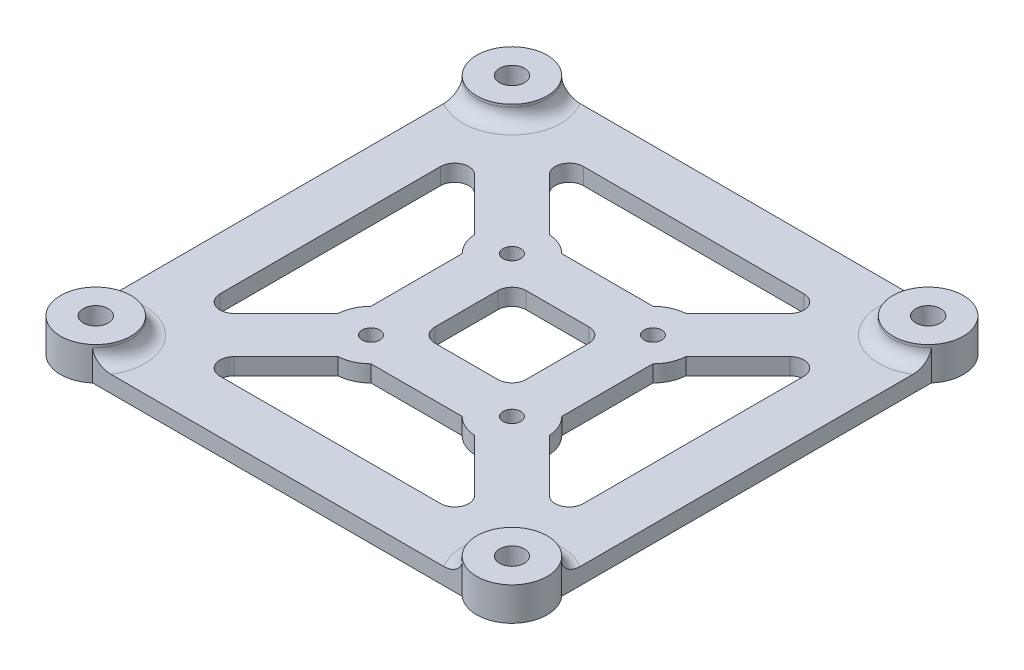
from build123d import *

# Parameters (mm, degrees)
BOSS_EXTRUDE1_DEPTH                        = 3
SKETCH2_R                                  = 6.35
BOSS_EXTRUDE2_DEPTH                        = 3
SKETCH3_R                                  = 1.5875
CUT_EXTRUDE1_DEPTH                         = 63.085787424
FILLET1_R                                  = 2.54
SKETCH4_R                                  = 2.25
CUT_EXTRUDE2_DEPTH                         = 63.302849052
MIRROR1_AT_THE_SECOND_PLANE_COPY_1_SKETC_R = 2.25
MIRROR1_AT_THE_SECOND_PLANE_COPY_1_DEPTH   = 63.302849052
FILLET2_R                                  = 2.54


with BuildPart() as part:
    # Sketch1 → Boss-Extrude1 (new body)
    with BuildSketch(Plane(origin=(0, 0, 0), x_dir=(1, 0, 0), z_dir=(0, 1, 0))):
        with BuildLine():
            ThreePointArc((-32.7375, -33.299869794), (-33.009871939, -33.009871939), (-33.299869794, -32.7375))
            Line((-33.299869794, -32.7375), (-33.299869794, -33.299869794))
            Line((-33.299869794, -33.299869794), (-32.7375, -33.299869794))
        make_face()
        with BuildLine():
            Line((-33.299869794, -33.299869794), (-33.299869794, -32.7375))
            ThreePointArc((-33.299869794, -32.7375), (-37.897655495, -31.162463404), (-42.2625, -33.299869794))
            Line((-42.2625, -33.299869794), (-33.299869794, -33.299869794))
        make_face()
        with BuildLine():
            ThreePointArc((-31.15, -37.5), (-31.560118898, -35.25493597), (-32.7375, -33.299869794))
            Line((-32.7375, -33.299869794), (-33.299869794, -33.299869794))
            Line((-33.299869794, -33.299869794), (-33.299869794, -42.2625))
            ThreePointArc((-33.299869794, -42.2625), (-31.712369794, -40.112630206), (-31.15, -37.5))
        make_face()
        with BuildLine():
            Line((-33.299869794, -42.2625), (-33.299869794, -33.299869794))
            Line((-33.299869794, -33.299869794), (-42.2625, -33.299869794))
            ThreePointArc((-42.2625, -33.299869794), (-41.990128061, -41.990128061), (-33.299869794, -42.2625))
        make_face()
        with BuildLine():
            Line((26.002307909, -32.7375), (-26.002307909, -32.7375))
            Line((-26.002307909, -32.7375), (-32.7375, -32.7375))
            Line((-32.7375, -32.7375), (-32.7375, -33.299869794))
            ThreePointArc((-32.7375, -33.299869794), (-31.560118898, -35.25493597), (-31.15, -37.5))
            ThreePointArc((-31.15, -37.5), (-31.712369794, -40.112630206), (-33.299869794, -42.2625))
            Line((-33.299869794, -42.2625), (33.299869794, -42.2625))
            ThreePointArc((33.299869794, -42.2625), (31.162463404, -37.897655495), (32.7375, -33.299869794))
            Line((32.7375, -33.299869794), (32.7375, -32.7375))
            Line((32.7375, -32.7375), (26.002307909, -32.7375))
        make_face()
        with BuildLine():
            Line((-32.7375, -32.7375), (-26.002307909, -32.7375))
            Line((-26.002307909, -32.7375), (-12.302344505, -19.037536596))
            ThreePointArc((-12.302344505, -19.037536596), (-17.190128061, -17.190128061), (-19.037536596, -12.302344505))
            Line((-19.037536596, -12.302344505), (-32.7375, -26.002307909))
            Line((-32.7375, -26.002307909), (-32.7375, -32.7375))
        make_face()
        with BuildLine():
            Line((-33.299869794, -32.7375), (-32.7375, -32.7375))
            Line((-32.7375, -32.7375), (-32.7375, -26.002307909))
            Line((-32.7375, -26.002307909), (-32.7375, 26.002307909))
            Line((-32.7375, 26.002307909), (-32.7375, 32.7375))
            Line((-32.7375, 32.7375), (-33.299869794, 32.7375))
            ThreePointArc((-33.299869794, 32.7375), (-37.897655495, 31.162463404), (-42.2625, 33.299869794))
            Line((-42.2625, 33.299869794), (-42.2625, -33.299869794))
            ThreePointArc((-42.2625, -33.299869794), (-37.897655495, -31.162463404), (-33.299869794, -32.7375))
        make_face()
        with BuildLine():
            ThreePointArc((-19.037536596, -12.302344505), (-17.190128061, -17.190128061), (-12.302344505, -19.037536596))
            ThreePointArc((-12.302344505, -19.037536596), (-10.087369794, -18.487630206), (-8.209871939, -17.190128061))
            Line((-8.209871939, -17.190128061), (-8.209871939, -8.209871939))
            Line((-8.209871939, -8.209871939), (-17.190128061, -8.209871939))
            ThreePointArc((-17.190128061, -8.209871939), (-18.487630206, -10.087369794), (-19.037536596, -12.302344505))
        make_face()
        with BuildLine():
            ThreePointArc((-6.35, -12.7), (-6.833364969, -15.130039796), (-8.209871939, -17.190128061))
            Line((-8.209871939, -17.190128061), (8.209871939, -17.190128061))
            ThreePointArc((8.209871939, -17.190128061), (6.35, -12.7), (8.209871939, -8.209871939))
            Line((8.209871939, -8.209871939), (-8.209871939, -8.209871939))
            ThreePointArc((-8.209871939, -8.209871939), (-6.833364969, -10.269960204), (-6.35, -12.7))
        make_face()
        with BuildLine():
            Line((-8.209871939, -8.209871939), (-8.209871939, -17.190128061))
            ThreePointArc((-8.209871939, -17.190128061), (-6.833364969, -15.130039796), (-6.35, -12.7))
            ThreePointArc((-6.35, -12.7), (-6.833364969, -10.269960204), (-8.209871939, -8.209871939))
        make_face()
        with BuildLine():
            ThreePointArc((-8.209871939, -8.209871939), (-12.7, -6.35), (-17.190128061, -8.209871939))
            Line((-17.190128061, -8.209871939), (-8.209871939, -8.209871939))
        make_face()
        with BuildLine():
            Line((-17.190128061, 8.209871939), (-17.190128061, -8.209871939))
            ThreePointArc((-17.190128061, -8.209871939), (-12.7, -6.35), (-8.209871939, -8.209871939))
            Line((-8.209871939, -8.209871939), (-8.209871939, 8.209871939))
            ThreePointArc((-8.209871939, 8.209871939), (-12.7, 6.35), (-17.190128061, 8.209871939))
        make_face()
        with BuildLine():
            ThreePointArc((8.209871939, -8.209871939), (6.35, -12.7), (8.209871939, -17.190128061))
            Line((8.209871939, -17.190128061), (8.209871939, -8.209871939))
        make_face()
        with BuildLine():
            ThreePointArc((8.209871939, -17.190128061), (10.087369794, -18.487630206), (12.302344505, -19.037536596))
            ThreePointArc((12.302344505, -19.037536596), (17.047262795, -17.328585766), (19.05, -12.7))
            ThreePointArc((19.05, -12.7), (19.046883384, -12.501074619), (19.037536596, -12.302344505))
            ThreePointArc((19.037536596, -12.302344505), (18.487630206, -10.087369794), (17.190128061, -8.209871939))
            Line((17.190128061, -8.209871939), (8.209871939, -8.209871939))
            Line((8.209871939, -8.209871939), (8.209871939, -17.190128061))
        make_face()
        with BuildLine():
            ThreePointArc((17.190128061, -8.209871939), (12.7, -6.35), (8.209871939, -8.209871939))
            Line((8.209871939, -8.209871939), (17.190128061, -8.209871939))
        make_face()
        with BuildLine():
            Line((12.302344505, -19.037536596), (26.002307909, -32.7375))
            Line((26.002307909, -32.7375), (32.7375, -32.7375))
            Line((32.7375, -32.7375), (32.7375, -26.002307909))
            Line((32.7375, -26.002307909), (19.037536596, -12.302344505))
            ThreePointArc((19.037536596, -12.302344505), (19.046883384, -12.501074619), (19.05, -12.7))
            ThreePointArc((19.05, -12.7), (17.047262795, -17.328585766), (12.302344505, -19.037536596))
        make_face()
        with BuildLine():
            ThreePointArc((42.2625, -33.299869794), (37.897655495, -31.162463404), (33.299869794, -32.7375))
            Line((33.299869794, -32.7375), (33.299869794, -33.299869794))
            Line((33.299869794, -33.299869794), (42.2625, -33.299869794))
        make_face()
        with BuildLine():
            Line((33.299869794, -33.299869794), (33.299869794, -32.7375))
            ThreePointArc((33.299869794, -32.7375), (33.009871939, -33.009871939), (32.7375, -33.299869794))
            Line((32.7375, -33.299869794), (33.299869794, -33.299869794))
        make_face()
        with BuildLine():
            Line((33.299869794, -33.299869794), (32.7375, -33.299869794))
            ThreePointArc((32.7375, -33.299869794), (31.162463404, -37.897655495), (33.299869794, -42.2625))
            Line((33.299869794, -42.2625), (33.299869794, -33.299869794))
        make_face()
        with BuildLine():
            Line((42.2625, -33.299869794), (33.299869794, -33.299869794))
            Line((33.299869794, -33.299869794), (33.299869794, -42.2625))
            ThreePointArc((33.299869794, -42.2625), (40.112630206, -43.287630206), (43.85, -37.5))
            ThreePointArc((43.85, -37.5), (43.439881102, -35.25493597), (42.2625, -33.299869794))
        make_face()
        with BuildLine():
            Line((33.299869794, -32.7375), (32.7375, -32.7375))
            Line((32.7375, -32.7375), (32.7375, -33.299869794))
            ThreePointArc((32.7375, -33.299869794), (33.009871939, -33.009871939), (33.299869794, -32.7375))
        make_face()
        with BuildLine():
            Line((32.7375, -26.002307909), (32.7375, -32.7375))
            Line((32.7375, -32.7375), (33.299869794, -32.7375))
            ThreePointArc((33.299869794, -32.7375), (37.897655495, -31.162463404), (42.2625, -33.299869794))
            Line((42.2625, -33.299869794), (42.2625, 33.299869794))
            ThreePointArc((42.2625, 33.299869794), (37.897655495, 31.162463404), (33.299869794, 32.7375))
            Line((33.299869794, 32.7375), (32.7375, 32.7375))
            Line((32.7375, 32.7375), (32.7375, 26.002307909))
            Line((32.7375, 26.002307909), (32.7375, -26.002307909))
        make_face()
        with BuildLine():
            Line((-32.7375, -33.299869794), (-32.7375, -32.7375))
            Line((-32.7375, -32.7375), (-33.299869794, -32.7375))
            ThreePointArc((-33.299869794, -32.7375), (-33.009871939, -33.009871939), (-32.7375, -33.299869794))
        make_face()
        with BuildLine():
            Line((-8.209871939, 8.209871939), (-17.190128061, 8.209871939))
            ThreePointArc((-17.190128061, 8.209871939), (-12.7, 6.35), (-8.209871939, 8.209871939))
        make_face()
        with BuildLine():
            ThreePointArc((-19.037536596, 12.302344505), (-18.487630206, 10.087369794), (-17.190128061, 8.209871939))
            Line((-17.190128061, 8.209871939), (-8.209871939, 8.209871939))
            Line((-8.209871939, 8.209871939), (-8.209871939, 17.190128061))
            ThreePointArc((-8.209871939, 17.190128061), (-10.087369794, 18.487630206), (-12.302344505, 19.037536596))
            ThreePointArc((-12.302344505, 19.037536596), (-17.190128061, 17.190128061), (-19.037536596, 12.302344505))
        make_face()
        with BuildLine():
            Line((-8.209871939, 17.190128061), (-8.209871939, 8.209871939))
            ThreePointArc((-8.209871939, 8.209871939), (-6.833364969, 10.269960204), (-6.35, 12.7))
            ThreePointArc((-6.35, 12.7), (-6.833364969, 15.130039796), (-8.209871939, 17.190128061))
        make_face()
        with BuildLine():
            ThreePointArc((-6.35, 12.7), (-6.833364969, 10.269960204), (-8.209871939, 8.209871939))
            Line((-8.209871939, 8.209871939), (8.209871939, 8.209871939))
            ThreePointArc((8.209871939, 8.209871939), (6.35, 12.7), (8.209871939, 17.190128061))
            Line((8.209871939, 17.190128061), (-8.209871939, 17.190128061))
            ThreePointArc((-8.209871939, 17.190128061), (-6.833364969, 15.130039796), (-6.35, 12.7))
        make_face()
        with BuildLine():
            ThreePointArc((8.209871939, 17.190128061), (6.35, 12.7), (8.209871939, 8.209871939))
            Line((8.209871939, 8.209871939), (8.209871939, 17.190128061))
        make_face()
        with BuildLine():
            Line((8.209871939, 17.190128061), (8.209871939, 8.209871939))
            Line((8.209871939, 8.209871939), (17.190128061, 8.209871939))
            ThreePointArc((17.190128061, 8.209871939), (18.487630206, 10.087369794), (19.037536596, 12.302344505))
            ThreePointArc((19.037536596, 12.302344505), (19.046883384, 12.501074619), (19.05, 12.7))
            ThreePointArc((19.05, 12.7), (17.047262795, 17.328585766), (12.302344505, 19.037536596))
            ThreePointArc((12.302344505, 19.037536596), (10.087369794, 18.487630206), (8.209871939, 17.190128061))
        make_face()
        with BuildLine():
            Line((17.190128061, 8.209871939), (8.209871939, 8.209871939))
            ThreePointArc((8.209871939, 8.209871939), (12.7, 6.35), (17.190128061, 8.209871939))
        make_face()
        with BuildLine():
            Line((8.209871939, 8.209871939), (8.209871939, -8.209871939))
            ThreePointArc((8.209871939, -8.209871939), (12.7, -6.35), (17.190128061, -8.209871939))
            Line((17.190128061, -8.209871939), (17.190128061, 8.209871939))
            ThreePointArc((17.190128061, 8.209871939), (12.7, 6.35), (8.209871939, 8.209871939))
        make_face()
        with BuildLine():
            Line((19.037536596, 12.302344505), (32.7375, 26.002307909))
            Line((32.7375, 26.002307909), (32.7375, 32.7375))
            Line((32.7375, 32.7375), (26.002307909, 32.7375))
            Line((26.002307909, 32.7375), (12.302344505, 19.037536596))
            ThreePointArc((12.302344505, 19.037536596), (17.047262795, 17.328585766), (19.05, 12.7))
            ThreePointArc((19.05, 12.7), (19.046883384, 12.501074619), (19.037536596, 12.302344505))
        make_face()
        with BuildLine():
            Line((-32.7375, 32.7375), (-32.7375, 26.002307909))
            Line((-32.7375, 26.002307909), (-19.037536596, 12.302344505))
            ThreePointArc((-19.037536596, 12.302344505), (-17.190128061, 17.190128061), (-12.302344505, 19.037536596))
            Line((-12.302344505, 19.037536596), (-26.002307909, 32.7375))
            Line((-26.002307909, 32.7375), (-32.7375, 32.7375))
        make_face()
        with BuildLine():
            ThreePointArc((33.299869794, 32.7375), (37.897655495, 31.162463404), (42.2625, 33.299869794))
            Line((42.2625, 33.299869794), (33.299869794, 33.299869794))
            Line((33.299869794, 33.299869794), (33.299869794, 32.7375))
        make_face()
        with BuildLine():
            Line((33.299869794, 33.299869794), (42.2625, 33.299869794))
            ThreePointArc((42.2625, 33.299869794), (43.439881102, 35.25493597), (43.85, 37.5))
            ThreePointArc((43.85, 37.5), (40.112630206, 43.287630206), (33.299869794, 42.2625))
            Line((33.299869794, 42.2625), (33.299869794, 33.299869794))
        make_face()
        with BuildLine():
            Line((33.299869794, 32.7375), (33.299869794, 33.299869794))
            Line((33.299869794, 33.299869794), (32.7375, 33.299869794))
            ThreePointArc((32.7375, 33.299869794), (33.009871939, 33.009871939), (33.299869794, 32.7375))
        make_face()
        with BuildLine():
            Line((32.7375, 33.299869794), (33.299869794, 33.299869794))
            Line((33.299869794, 33.299869794), (33.299869794, 42.2625))
            ThreePointArc((33.299869794, 42.2625), (31.162463404, 37.897655495), (32.7375, 33.299869794))
        make_face()
        with BuildLine():
            Line((32.7375, 33.299869794), (32.7375, 32.7375))
            Line((32.7375, 32.7375), (33.299869794, 32.7375))
            ThreePointArc((33.299869794, 32.7375), (33.009871939, 33.009871939), (32.7375, 33.299869794))
        make_face()
        with BuildLine():
            Line((-32.7375, 33.299869794), (-32.7375, 32.7375))
            Line((-32.7375, 32.7375), (-26.002307909, 32.7375))
            Line((-26.002307909, 32.7375), (26.002307909, 32.7375))
            Line((26.002307909, 32.7375), (32.7375, 32.7375))
            Line((32.7375, 32.7375), (32.7375, 33.299869794))
            ThreePointArc((32.7375, 33.299869794), (31.162463404, 37.897655495), (33.299869794, 42.2625))
            Line((33.299869794, 42.2625), (-33.299869794, 42.2625))
            ThreePointArc((-33.299869794, 42.2625), (-31.712369794, 40.112630206), (-31.15, 37.5))
            ThreePointArc((-31.15, 37.5), (-31.560118898, 35.25493597), (-32.7375, 33.299869794))
        make_face()
        with BuildLine():
            ThreePointArc((-33.299869794, 42.2625), (-41.990128061, 41.990128061), (-42.2625, 33.299869794))
            Line((-42.2625, 33.299869794), (-33.299869794, 33.299869794))
            Line((-33.299869794, 33.299869794), (-33.299869794, 42.2625))
        make_face()
        with BuildLine():
            Line((-33.299869794, 33.299869794), (-42.2625, 33.299869794))
            ThreePointArc((-42.2625, 33.299869794), (-37.897655495, 31.162463404), (-33.299869794, 32.7375))
            Line((-33.299869794, 32.7375), (-33.299869794, 33.299869794))
        make_face()
        with BuildLine():
            Line((-32.7375, 33.299869794), (-33.299869794, 33.299869794))
            Line((-33.299869794, 33.299869794), (-33.299869794, 32.7375))
            ThreePointArc((-33.299869794, 32.7375), (-33.009871939, 33.009871939), (-32.7375, 33.299869794))
        make_face()
        with BuildLine():
            Line((-33.299869794, 42.2625), (-33.299869794, 33.299869794))
            Line((-33.299869794, 33.299869794), (-32.7375, 33.299869794))
            ThreePointArc((-32.7375, 33.299869794), (-31.560118898, 35.25493597), (-31.15, 37.5))
            ThreePointArc((-31.15, 37.5), (-31.712369794, 40.112630206), (-33.299869794, 42.2625))
        make_face()
        with BuildLine():
            Line((-33.299869794, 32.7375), (-32.7375, 32.7375))
            Line((-32.7375, 32.7375), (-32.7375, 33.299869794))
            ThreePointArc((-32.7375, 33.299869794), (-33.009871939, 33.009871939), (-33.299869794, 32.7375))
        make_face()
    extrude(amount=BOSS_EXTRUDE1_DEPTH)

    # Sketch2 → Boss-Extrude2 (add)
    with BuildSketch(Plane(origin=(0, 3, 0), x_dir=(1, 0, 0), z_dir=(0, 1, 0))):
        with Locations(Location((-37.5, 37.5, 0), (0, 0, 48.590377891))):
            Circle(SKETCH2_R)
        with Locations(Location((37.5, 37.5, 0), (0, 0, 131.409622109))):
            Circle(SKETCH2_R)
        with Locations(Location((37.5, -37.5, 0), (0, 0, 41.409622109))):
            Circle(SKETCH2_R)
        with Locations(Location((-37.5, -37.5, 0), (0, 0, 138.590377891))):
            Circle(SKETCH2_R)
    extrude(amount=BOSS_EXTRUDE2_DEPTH)

    # Sketch3 → Cut-Extrude1 (cut, through all)
    with BuildSketch(Plane(origin=(0, 3, 0), x_dir=(1, 0, 0), z_dir=(0, 1, 0))):
        with Locations(Location((-12.7, 12.7, 0), (0, 0, 270))):
            Circle(SKETCH3_R)
        with Locations(Location((12.7, 12.7, 0), (0, 0, 270))):
            Circle(SKETCH3_R)
        with Locations(Location((12.7, -12.7, 0), (0, 0, 270))):
            Circle(SKETCH3_R)
        with Locations(Location((-12.7, -12.7, 0), (0, 0, 270))):
            Circle(SKETCH3_R)
    extrude(amount=-CUT_EXTRUDE1_DEPTH, mode=Mode.SUBTRACT)

    # Fillet1
    fillet1_edges = [part.edges().sort_by_distance(p)[0] for p in [
        (-32.7375, 1.5, -26.002307909),
        (-32.7375, 1.5, 26.002307909),
        (-26.002307909, 1.5, 32.7375),
        (26.002307909, 1.5, 32.7375),
        (26.002307909, 1.5, -32.7375),
        (-26.002307909, 1.5, -32.7375),
        (32.7375, 1.5, 26.002307909),
        (32.7375, 1.5, -26.002307909),
        (-8.209871939, 1.5, -8.209871939),
        (-8.209871939, 1.5, 8.209871939),
        (8.209871939, 1.5, 8.209871939),
        (8.209871939, 1.5, -8.209871939),
    ]]
    fillet(fillet1_edges, radius=FILLET1_R)

    # Sketch4 → Cut-Extrude2 (cut, through all)
    with BuildSketch(Plane(origin=(0, 6, 0), x_dir=(1, 0, 0), z_dir=(0, 1, 0))):
        with Locations(Location((-37.5, 37.5, 0), (0, 0, 270))):
            Circle(SKETCH4_R)
    cut_extrude2 = extrude(amount=-CUT_EXTRUDE2_DEPTH, mode=Mode.SUBTRACT)

    # Mirror1: Cut-Extrude2 across plane
    add(cut_extrude2.mirror(Plane(origin=(0, 0, 0), x_dir=(0, 0, 1), z_dir=(1, 0, 0))), mode=Mode.SUBTRACT)

    # Mirror1 at the second plane: Cut-Extrude2 across plane
    add(cut_extrude2.mirror(Plane.XY), mode=Mode.SUBTRACT)

    # Mirror1 at the second plane copy 1 sketc → Mirror1 at the second plane copy 1 (cut, through all)
    with BuildSketch(Plane(origin=(0, 6, 0), x_dir=(-1, 0, 0), z_dir=(0, 1, 0))):
        with Locations(Location((-37.5, 37.5, 0), (0, 0, 270))):
            Circle(MIRROR1_AT_THE_SECOND_PLANE_COPY_1_SKETC_R)
    extrude(amount=-MIRROR1_AT_THE_SECOND_PLANE_COPY_1_DEPTH, mode=Mode.SUBTRACT)

    # Fillet2
    # the kernel refuses this fillet: 2.54 mm, written as the material it adds along each edge
    with BuildSketch(Plane(origin=(-37.5, 3, -37.5), x_dir=(-0.9613299443366871, 0, -0.2753992340614298), z_dir=(0.2753992340614298, 0, -0.9613299443366871))) as fillet2_piece_1_section:
        with BuildLine():
            CenterArc((6.35 + FILLET2_R, FILLET2_R), FILLET2_R, 180, 90)
            Line((6.35, FILLET2_R), (6.35, 0))
            Line((6.35, 0), (6.35 + FILLET2_R, 0))
        make_face()
    fillet2_piece_1 = revolve(axis=Axis((-37.5, 3, -37.5), (0, 1, 0)), revolution_arc=301.971614625, mode=Mode.PRIVATE)
    fillet2_piece_1 = split(fillet2_piece_1, bisect_by=Plane(origin=(-32.500211641, 3.720768507, -42.2625), z_dir=(0, 0, 1)), keep=Keep.TOP, mode=Mode.PRIVATE)
    fillet2_piece_1 = split(fillet2_piece_1, bisect_by=Plane(origin=(-42.2625, 3.720768507, -32.500211641), z_dir=(1, 0, 0)), keep=Keep.TOP, mode=Mode.PRIVATE)
    add(fillet2_piece_1)
    with BuildSketch(Plane(origin=(37.5, 3, -37.5), x_dir=(0.2753992340659741, 0, -0.9613299443353853), z_dir=(0.9613299443353853, 0, 0.2753992340659741))) as fillet2_piece_2_section:
        with BuildLine():
            CenterArc((6.35 + FILLET2_R, FILLET2_R), FILLET2_R, 180, 90)
            Line((6.35 + FILLET2_R, 0), (6.35, 0))
            Line((6.35, 0), (6.35, FILLET2_R))
        make_face()
    fillet2_piece_2 = revolve(axis=Axis((37.5, 3, -37.5), (0, 1, 0)), revolution_arc=301.971614625, mode=Mode.PRIVATE)
    fillet2_piece_2 = split(fillet2_piece_2, bisect_by=Plane(origin=(32.500211638, 3.720768511, -42.2625), z_dir=(0, 0, 1)), keep=Keep.TOP, mode=Mode.PRIVATE)
    fillet2_piece_2 = split(fillet2_piece_2, bisect_by=Plane(origin=(42.2625, 3.720768511, -32.500211638), z_dir=(-1, 0, 0)), keep=Keep.TOP, mode=Mode.PRIVATE)
    add(fillet2_piece_2)
    with BuildSketch(Plane(origin=(37.5, 3, 37.5), x_dir=(0.9613299443353853, 0, 0.2753992340659741), z_dir=(-0.2753992340659741, 0, 0.9613299443353853))) as fillet2_piece_3_section:
        with BuildLine():
            CenterArc((6.35 + FILLET2_R, FILLET2_R), FILLET2_R, 180, 90)
            Line((6.35 + FILLET2_R, 0), (6.35, 0))
            Line((6.35, 0), (6.35, FILLET2_R))
        make_face()
    fillet2_piece_3 = revolve(axis=Axis((37.5, 3, 37.5), (0, 1, 0)), revolution_arc=301.971614625, mode=Mode.PRIVATE)
    fillet2_piece_3 = split(fillet2_piece_3, bisect_by=Plane(origin=(42.2625, 3.720768511, 32.500211638), z_dir=(-1, 0, 0)), keep=Keep.TOP, mode=Mode.PRIVATE)
    fillet2_piece_3 = split(fillet2_piece_3, bisect_by=Plane(origin=(32.500211638, 3.720768511, 42.2625), z_dir=(0, 0, -1)), keep=Keep.TOP, mode=Mode.PRIVATE)
    add(fillet2_piece_3)
    with BuildSketch(Plane(origin=(-37.5, 3, 37.5), x_dir=(-0.2753992340614264, 0, 0.961329944336688), z_dir=(-0.961329944336688, 0, -0.2753992340614264))) as fillet2_piece_4_section:
        with BuildLine():
            CenterArc((6.35 + FILLET2_R, FILLET2_R), FILLET2_R, 180, 90)
            Line((6.35 + FILLET2_R, 0), (6.35, 0))
            Line((6.35, 0), (6.35, FILLET2_R))
        make_face()
    fillet2_piece_4 = revolve(axis=Axis((-37.5, 3, 37.5), (0, 1, 0)), revolution_arc=301.971614625, mode=Mode.PRIVATE)
    fillet2_piece_4 = split(fillet2_piece_4, bisect_by=Plane(origin=(-42.2625, 3.720768511, 32.500211638), z_dir=(1, 0, 0)), keep=Keep.TOP, mode=Mode.PRIVATE)
    fillet2_piece_4 = split(fillet2_piece_4, bisect_by=Plane(origin=(-32.500211638, 3.720768511, 42.2625), z_dir=(0, 0, -1)), keep=Keep.TOP, mode=Mode.PRIVATE)
    add(fillet2_piece_4)


solid = part.part
